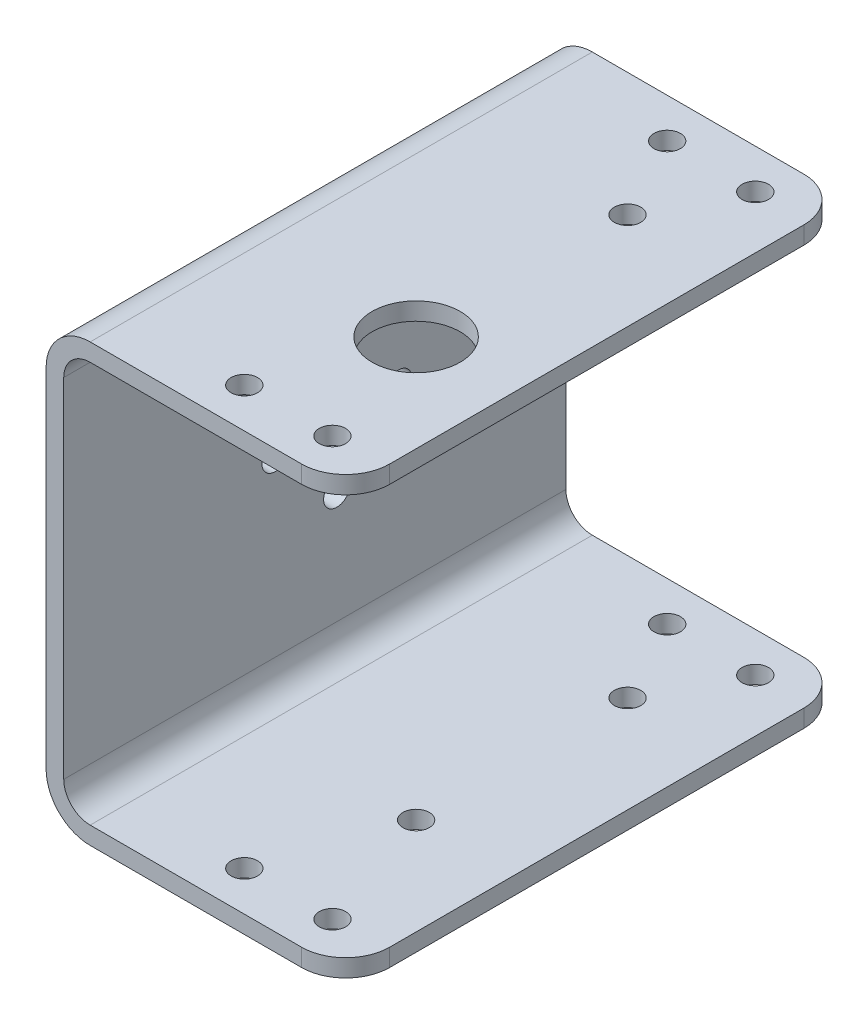
from build123d import *

# Parameters (mm, degrees)
EXTRUDE_1_DEPTH     = 57
SKETCH_2_R          = 1.5
CUT_EXTRUDE_1_DEPTH = 57
SKETCH_4_R          = 4
SKETCH_4_R_2        = 1.5
CUT_EXTRUDE_2_DEPTH = 57
FILLET_1_R          = 5
FILLET_2_R          = 3
FILLET_3_R          = 5
SKETCH_5_R          = 5
CUT_EXTRUDE_3_DEPTH = 26
SKETCH_6_R          = 1.5
CUT_EXTRUDE_4_DEPTH = 71


with BuildPart() as part:
    # 草图1 → 凸台-拉伸1 (new body)
    with BuildSketch(Plane.XY):
        Polygon((-17, -24.75), (17, -24.75), (17, -22.75), (-15, -22.75), (-15, 22.75), (17, 22.75), (17, 24.75), (-17, 24.75), align=None)
    extrude(amount=EXTRUDE_1_DEPTH)

    # 草图2 → 切除-拉伸1 (cut)
    with BuildSketch(Plane(origin=(0, 24.75, 0), x_dir=(1, 0, 0), z_dir=(0, 1, 0))):
        with Locations((6, -14)):
            Circle(SKETCH_2_R)
        with Locations((6, -38)):
            Circle(SKETCH_2_R)
    extrude(amount=-CUT_EXTRUDE_1_DEPTH, mode=Mode.SUBTRACT)

    # 草图4 → 切除-拉伸2 (cut)
    with BuildSketch(Plane.ZY.offset(17)):
        with Locations((26, 0)):
            Circle(SKETCH_4_R)
        with Locations((26, 7)):
            Circle(SKETCH_4_R_2)
        with Locations((33, 0)):
            Circle(SKETCH_4_R_2)
        with Locations((26, -7)):
            Circle(SKETCH_4_R_2)
        with Locations((19, 0)):
            Circle(SKETCH_4_R_2)
    extrude(amount=-CUT_EXTRUDE_2_DEPTH, mode=Mode.SUBTRACT)

    # 圆角1
    fillet_1_edges = [part.edges().sort_by_distance(p)[0] for p in [
        (-17, -24.75, 28.5),
        (-17, 24.75, 28.5),
    ]]
    fillet(fillet_1_edges, radius=FILLET_1_R)

    # 圆角2
    fillet_2_edges = [part.edges().sort_by_distance(p)[0] for p in [
        (-15, -22.75, 28.5),
        (-15, 22.75, 28.5),
    ]]
    fillet(fillet_2_edges, radius=FILLET_2_R)

    # 圆角3
    fillet_3_edges = [part.edges().sort_by_distance(p)[0] for p in [
        (17, 23.75, 0),
        (17, -23.75, 0),
        (17, 23.75, 57),
        (17, -23.75, 57),
    ]]
    fillet(fillet_3_edges, radius=FILLET_3_R)

    # 草图5 → 切除-拉伸3 (cut)
    with BuildSketch(Plane(origin=(0, 24.75, 0), x_dir=(1, 0, 0), z_dir=(0, 1, 0))):
        with Locations((6, -38)):
            Circle(SKETCH_5_R)
    extrude(amount=-CUT_EXTRUDE_3_DEPTH, mode=Mode.SUBTRACT)

    # 草图6 → 切除-拉伸4 (cut)
    with BuildSketch(Plane.XZ.offset(24.75)):
        with Locations((1, 52.5)):
            Circle(SKETCH_6_R)
        with Locations((11, 52.5)):
            Circle(SKETCH_6_R)
        with Locations((11, 4.5)):
            Circle(SKETCH_6_R)
        with Locations((1, 4.5)):
            Circle(SKETCH_6_R)
    extrude(amount=-CUT_EXTRUDE_4_DEPTH, mode=Mode.SUBTRACT)


solid = part.part
